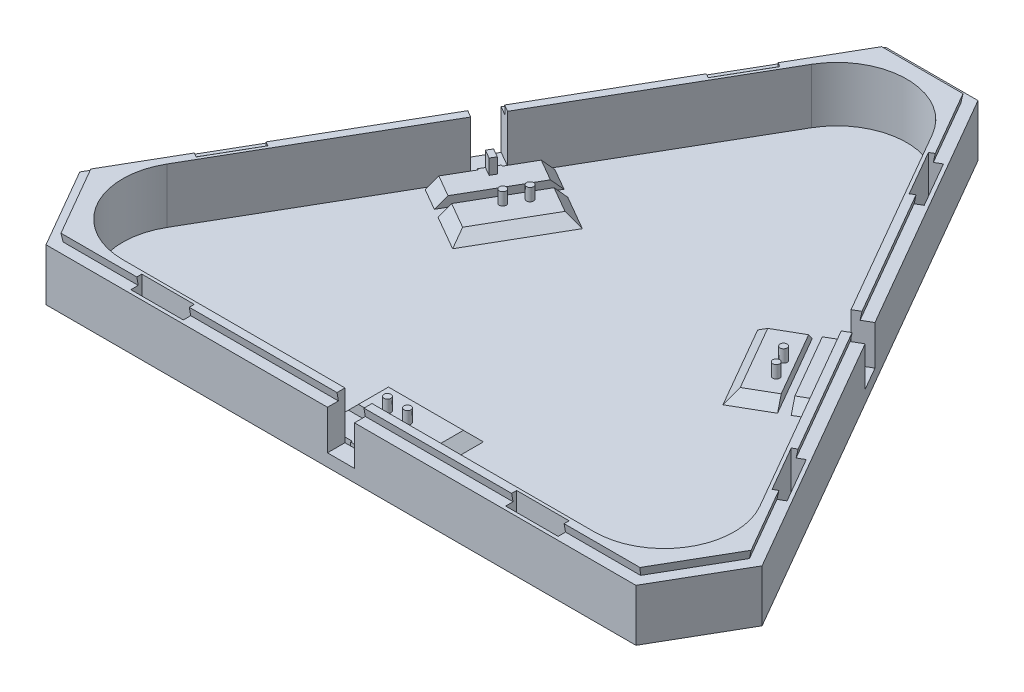
from build123d import *

# Parameters (mm, degrees)
BOSS_EXTRU_1_DEPTH                        = 12
ENL_V_MAT_EXTRU_1_DEPTH                   = 119.989845505
ENL_V_MAT_EXTRU_2_DEPTH                   = 11
ESQUISSE4_W                               = 5.4
ESQUISSE4_H                               = 3.5
ENL_V_MAT_EXTRU_3_DEPTH                   = 9.5
BOSS_EXTRU_2_DEPTH                        = 2
ESQUISSE13_R                              = 0.7
BOSS_EXTRU_3_DEPTH                        = 2.5
BOSS_EXTRU_8_DEPTH                        = 3
CHANFREIN4_SIZE                           = 2
ENL_V_MAT_EXTRU_11_DEPTH                  = 2
R_P_TITION_START                          = 1
R_P_TITION_CIRCULAIRE1_OUTLINE_W          = 1.2
R_P_TITION_CIRCULAIRE1_OUTLINE_H          = 2
R_P_TITION_CIRCULAIRE1_OUTLINE_R          = 0.7
R_P_TITION_CIRCULAIRE1_DEPTH              = 4.5
R_P_TITION_START_2                        = 5.5
R_P_TITION_CIRCULAIRE1_2_OUTLINE_W        = 1.2
R_P_TITION_CIRCULAIRE1_2_OUTLINE_H        = 2
R_P_TITION_CIRCULAIRE1_2_DEPTH            = 0.5
ENL_V_DE_MAT_EXTRU_MINCE1_DEPTH           = 1.6
ENL_V_DE_MAT_EXTRU_MINCE1_DRAFT           = 10
ENL_V_DE_MAT_EXTRU_MINCE1_PROFILE_2_DEPTH = 1.6
ENL_V_DE_MAT_EXTRU_MINCE1_PROFILE_2_DRAFT = 10
ENL_V_DE_MAT_EXTRU_MINCE1_PROFILE_3_DEPTH = 1.6
ENL_V_DE_MAT_EXTRU_MINCE1_PROFILE_3_DRAFT = 10
ESQUISSE18_W                              = 10.5
ESQUISSE18_H                              = 2.2
ENL_V_MAT_EXTRU_10_DEPTH                  = 11


with BuildPart() as part:
    # Esquisse1 → Boss.-Extru.1 (new body)
    with BuildSketch(Plane(origin=(0, 0, 0), x_dir=(1, 0, 0), z_dir=(0, 1, 0))):
        Polygon((-77.5, -44.744645862), (77.5, -44.744645862), (0, 89.489291724), align=None)
    extrude(amount=BOSS_EXTRU_1_DEPTH)

    # Esquisse2 → Enlèv. mat.-Extru.1 (cut, through all)
    with BuildSketch(Plane(origin=(0, 12, 0), x_dir=(1, 0, 0), z_dir=(0, 1, 0))):
        Polygon((-9.237604307, 73.489291724), (9.237604307, 73.489291724), (0, 89.489291724), align=None)
        Polygon((77.5, -44.744645862), (68.262395693, -28.744645862), (59.024791386, -44.744645862), align=None)
        Polygon((-77.5, -44.744645862), (-59.024791386, -44.744645862), (-68.262395693, -28.744645862), align=None)
    extrude(amount=-ENL_V_MAT_EXTRU_1_DEPTH, mode=Mode.SUBTRACT)

    # Esquisse3 → Enlèv. mat.-Extru.2 (cut)
    with BuildSketch(Plane(origin=(0, 12, 0), x_dir=(1, 0, 0), z_dir=(0, 1, 0))):
        with BuildLine():
            Line((59.313466521, -20.244645862), (12.124355653, 61.489291724))
            ThreePointArc((12.124355653, 61.489291724), (0, 68.489291724), (-12.124355653, 61.489291724))
            Line((-12.124355653, 61.489291724), (-59.313466521, -20.244645862))
            ThreePointArc((-59.313466521, -20.244645862), (-59.313466521, -34.244645862), (-47.189110868, -41.244645862))
            Line((-47.189110868, -41.244645862), (47.189110868, -41.244645862))
            ThreePointArc((47.189110868, -41.244645862), (59.313466521, -34.244645862), (59.313466521, -20.244645862))
        make_face()
    extrude(amount=-ENL_V_MAT_EXTRU_2_DEPTH, mode=Mode.SUBTRACT)

    # Esquisse4 → Enlèv. mat.-Extru.3 (cut)
    with BuildSketch(Plane(origin=(0, 12, 0), x_dir=(1, 0, 0), z_dir=(0, 1, 0))):
        Polygon((37.068911087, 18.284054341), (34.368911087, 22.960591521), (37.4, 24.710591521), (40.1, 20.034054341), align=None)
        with Locations((0, -42.994645862)):
            Rectangle(ESQUISSE4_W, ESQUISSE4_H)
        Polygon((-37.4, 24.710591521), (-34.368911087, 22.960591521), (-37.068911087, 18.284054341), (-40.1, 20.034054341), align=None)
    extrude(amount=-ENL_V_MAT_EXTRU_3_DEPTH, mode=Mode.SUBTRACT)

    # Esquisse12 → Boss.-Extru.2 (add)
    with BuildSketch(Plane(origin=(0, 1, 0), x_dir=(1, 0, 0), z_dir=(0, 1, 0))):
        Polygon((20.277568136, 20.367513459), (27.777568136, 7.377132403), (39.035898385, 13.877132403), (36.160898385, 18.856778474), (36.420706006, 19.006778474), (34.670706006, 22.037867388), (34.410898385, 21.887867388), (31.535898385, 26.867513459), align=None)
    extrude(amount=BOSS_EXTRU_2_DEPTH)

    # Esquisse13 → Boss.-Extru.3 (add)
    with BuildSketch(Plane(origin=(0, 3, 0), x_dir=(1, 0, 0), z_dir=(0, 1, 0))):
        with Locations(Location((27.414874832, 16.405335633, 0), (0, 0, 90))):
            Circle(ESQUISSE13_R)
        with Locations(Location((29.414874832, 12.941234018, 0), (0, 0, 90))):
            Circle(ESQUISSE13_R)
    extrude(amount=BOSS_EXTRU_3_DEPTH)

    # Esquisse20 → Boss.-Extru.8 (add, symmetric)
    with BuildSketch(Plane(origin=(0, 3, 0), x_dir=(1, 0, 0), z_dir=(0, 1, 0))):
        Polygon((35.245706006, 21.041938173), (35.845706006, 20.002707689), (34.113655198, 19.002707689), (33.513655198, 20.041938173), align=None)
    extrude(amount=BOSS_EXTRU_8_DEPTH, both=True)

    # Chanfrein4
    chanfrein4_edges = [part.edges().sort_by_distance(p)[0] for p in [
        (25.90673326, 1, -23.617513459),
        (24.027568136, 1, -13.872322931),
        (33.40673326, 1, -10.627132403),
    ]]
    chamfer(chanfrein4_edges, length=CHANFREIN4_SIZE - 0.0001)  # a hair under: the kernel refuses the full size

    # Esquisse21 → Enlèv. mat.-Extru.11 (cut)
    with BuildSketch(Plane(origin=(0, 3, 0), x_dir=(1, 0, 0), z_dir=(0, 1, 0))):
        Polygon((24.473720558, 25.099564267), (26.205771366, 26.099564267), (35.705771366, 9.645081595), (33.973720558, 8.645081595), align=None)
    extrude(amount=-ENL_V_MAT_EXTRU_11_DEPTH, mode=Mode.SUBTRACT)

    # Répétition circulaire1: read off the stored shape, not the designer's step
    # Répétition circulaire1 outline → Répétition circulaire1 (add)
    with BuildSketch(Plane(origin=(0, 0, 0), x_dir=(1, 0, 0), z_dir=(0, 1, 0)).offset(R_P_TITION_START)):
        Polygon((-35.245706006, 21.041938173), (-35.845706006, 20.002707689), (-34.113655198, 19.002707689), (-33.513655198, 20.041938173), align=None)
        with Locations((0, -40.044645862)):
            Rectangle(R_P_TITION_CIRCULAIRE1_OUTLINE_W, R_P_TITION_CIRCULAIRE1_OUTLINE_H)
        with Locations((-27.914874832, 15.539310229)):
            Circle(R_P_TITION_CIRCULAIRE1_OUTLINE_R)
        with Locations((-25.914874832, 19.003411844)):
            Circle(R_P_TITION_CIRCULAIRE1_OUTLINE_R)
        with Locations((0.5, -31.944645862)):
            Circle(R_P_TITION_CIRCULAIRE1_OUTLINE_R)
        with Locations((-3.5, -31.944645862)):
            Circle(R_P_TITION_CIRCULAIRE1_OUTLINE_R)
    extrude(amount=R_P_TITION_CIRCULAIRE1_DEPTH)

    # R_p_tition circulaire1 2 outline → R_p_tition circulaire1 2 (add)
    with BuildSketch(Plane(origin=(0, 0, 0), x_dir=(1, 0, 0), z_dir=(0, 1, 0)).offset(R_P_TITION_START_2)):
        Polygon((-35.245706006, 21.041938173), (-35.845706006, 20.002707689), (-34.113655198, 19.002707689), (-33.513655198, 20.041938173), align=None)
        with Locations((0, -40.044645862)):
            Rectangle(R_P_TITION_CIRCULAIRE1_2_OUTLINE_W, R_P_TITION_CIRCULAIRE1_2_OUTLINE_H)
    extrude(amount=R_P_TITION_CIRCULAIRE1_2_DEPTH)

    # R_p_tition circulaire1 3: loft between two sections, ruled curve by curve
    r_p_tition_circulaire1_3_from = [
        Edge.make_line((-25.473720558, 3, -23.367513459), (-20.277568136, 3, -20.367513459)),
        Edge.make_line((-32.973720558, 3, -10.377132403), (-27.777568136, 3, -7.377132403)),
        Edge.make_line((-20.277568136, 3, -20.367513459), (-27.777568136, 3, -7.377132403)),
        Edge.make_line((-32.973720558, 3, -10.377132403), (-25.473720558, 3, -23.367513459)),
    ]
    r_p_tition_circulaire1_3_to = [
        Edge.make_line((-24.473720558, 1, -25.099564267), (-17.545517328, 1, -21.099564267)),
        Edge.make_line((-33.973720558, 1, -8.645081595), (-27.045517328, 1, -4.645081595)),
        Edge.make_line((-17.545517328, 1, -21.099564267), (-27.045517328, 1, -4.645081595)),
        Edge.make_line((-33.973720558, 1, -8.645081595), (-24.473720558, 1, -25.099564267)),
    ]
    r_p_tition_circulaire1_3 = Solid(Shell([*[Face.make_surface_from_curves(r_p_tition_circulaire1_3_from[k], r_p_tition_circulaire1_3_to[k]) for k in range(4)], Face(Wire(r_p_tition_circulaire1_3_from)), Face(Wire(r_p_tition_circulaire1_3_to))]))
    add(r_p_tition_circulaire1_3)

    # R_p_tition circulaire1 4: loft between two sections, ruled curve by curve
    r_p_tition_circulaire1_4_from = [
        Edge.make_line((-7.5, 3, 33.744645862), (-7.5, 3, 27.744645862)),
        Edge.make_line((7.5, 3, 33.744645862), (7.5, 3, 27.744645862)),
        Edge.make_line((-7.5, 3, 27.744645862), (7.5, 3, 27.744645862)),
        Edge.make_line((7.5, 3, 33.744645862), (-7.5, 3, 33.744645862)),
    ]
    r_p_tition_circulaire1_4_to = [
        Edge.make_line((-9.5, 1, 33.744645862), (-9.5, 1, 25.744645862)),
        Edge.make_line((9.5, 1, 33.744645862), (9.5, 1, 25.744645862)),
        Edge.make_line((-9.5, 1, 25.744645862), (9.5, 1, 25.744645862)),
        Edge.make_line((9.5, 1, 33.744645862), (-9.5, 1, 33.744645862)),
    ]
    r_p_tition_circulaire1_4 = Solid(Shell([*[Face.make_surface_from_curves(r_p_tition_circulaire1_4_from[k], r_p_tition_circulaire1_4_to[k]) for k in range(4)], Face(Wire(r_p_tition_circulaire1_4_from)), Face(Wire(r_p_tition_circulaire1_4_to))]))
    add(r_p_tition_circulaire1_4)

    # R_p_tition circulaire1 5: loft between two sections, ruled curve by curve
    r_p_tition_circulaire1_5_from = [
        Edge.make_line((-27.205771366, 3, -24.367513459), (-31.535898385, 3, -26.867513459)),
        Edge.make_line((-34.705771366, 3, -11.377132403), (-39.035898385, 3, -13.877132403)),
        Edge.make_line((-34.410898385, 3, -21.887867388), (-31.535898385, 3, -26.867513459)),
        Edge.make_line((-39.035898385, 3, -13.877132403), (-36.160898385, 3, -18.856778474)),
        Edge.make_line((-34.670706006, 3, -22.037867388), (-34.410898385, 3, -21.887867388)),
        Edge.make_line((-36.160898385, 3, -18.856778474), (-36.420706006, 3, -19.006778474)),
        Edge.make_line((-27.205771366, 3, -24.367513459), (-34.705771366, 3, -11.377132403)),
        Edge.make_line((-36.420706006, 3, -19.006778474), (-34.670706006, 3, -22.037867388)),
    ]
    r_p_tition_circulaire1_5_to = [
        Edge.make_line((-26.205771366, 1, -26.099564267), (-30.535898385, 1, -28.599564267)),
        Edge.make_line((-35.705771366, 1, -9.645081595), (-40.035898385, 1, -12.145081595)),
        Edge.make_line((-34.410898385, 1, -21.887867388), (-30.535898385, 1, -28.599564267)),
        Edge.make_line((-40.035898385, 1, -12.145081595), (-36.160898385, 1, -18.856778474)),
        Edge.make_line((-34.670706006, 1, -22.037867388), (-34.410898385, 1, -21.887867388)),
        Edge.make_line((-36.160898385, 1, -18.856778474), (-36.420706006, 1, -19.006778474)),
        Edge.make_line((-26.205771366, 1, -26.099564267), (-35.705771366, 1, -9.645081595)),
        Edge.make_line((-36.420706006, 1, -19.006778474), (-34.670706006, 1, -22.037867388)),
    ]
    r_p_tition_circulaire1_5 = Solid(Shell([*[Face.make_surface_from_curves(r_p_tition_circulaire1_5_from[k], r_p_tition_circulaire1_5_to[k]) for k in range(8)], Face(Wire(r_p_tition_circulaire1_5_from)), Face(Wire(r_p_tition_circulaire1_5_to))]))
    add(r_p_tition_circulaire1_5)

    # R_p_tition circulaire1 6: loft between two sections, ruled curve by curve
    r_p_tition_circulaire1_6_from = [
        Edge.make_line((-7.5, 3, 35.744645862), (-7.5, 3, 40.744645862)),
        Edge.make_line((7.5, 3, 35.744645862), (7.5, 3, 40.744645862)),
        Edge.make_line((-1.75, 3, 40.744645862), (-7.5, 3, 40.744645862)),
        Edge.make_line((7.5, 3, 40.744645862), (1.75, 3, 40.744645862)),
        Edge.make_line((-1.75, 3, 41.044645862), (-1.75, 3, 40.744645862)),
        Edge.make_line((1.75, 3, 40.744645862), (1.75, 3, 41.044645862)),
        Edge.make_line((-7.5, 3, 35.744645862), (7.5, 3, 35.744645862)),
        Edge.make_line((1.75, 3, 41.044645862), (-1.75, 3, 41.044645862)),
    ]
    r_p_tition_circulaire1_6_to = [
        Edge.make_line((-9.5, 1, 35.744645862), (-9.5, 1, 40.744645862)),
        Edge.make_line((9.5, 1, 35.744645862), (9.5, 1, 40.744645862)),
        Edge.make_line((-1.75, 1, 40.744645862), (-9.5, 1, 40.744645862)),
        Edge.make_line((9.5, 1, 40.744645862), (1.75, 1, 40.744645862)),
        Edge.make_line((-1.75, 1, 41.044645862), (-1.75, 1, 40.744645862)),
        Edge.make_line((1.75, 1, 40.744645862), (1.75, 1, 41.044645862)),
        Edge.make_line((-9.5, 1, 35.744645862), (9.5, 1, 35.744645862)),
        Edge.make_line((1.75, 1, 41.044645862), (-1.75, 1, 41.044645862)),
    ]
    r_p_tition_circulaire1_6 = Solid(Shell([*[Face.make_surface_from_curves(r_p_tition_circulaire1_6_from[k], r_p_tition_circulaire1_6_to[k]) for k in range(8)], Face(Wire(r_p_tition_circulaire1_6_from)), Face(Wire(r_p_tition_circulaire1_6_to))]))
    add(r_p_tition_circulaire1_6)


with BuildPart() as enl_v_de_mat_extru_mince1_tool:
    # Esquisse17 → Enlèv. de mat.-Extru.-Mince1 (with draft: the straight prism first)
    with BuildSketch(Plane(origin=(0, 12, 0), x_dir=(1, 0, 0), z_dir=(0, 1, 0))):
        Polygon((37.4, 24.710591521), (9.237604307, 73.489291724), (-9.237604307, 73.489291724), (-37.4, 24.710591521), (-35.754551733, 23.760591521), (-8.140638796, 71.589291724), (8.140638796, 71.589291724), (35.754551733, 23.760591521), align=None)
    extrude(amount=-ENL_V_DE_MAT_EXTRU_MINCE1_DEPTH)
    # Enlèv. de mat.-Extru.-Mince1: the draft: its side faces are tilted about the plane it starts from
    enl_v_de_mat_extru_mince1_sides = [enl_v_de_mat_extru_mince1_tool.faces().sort_by_distance(p)[0] for p in [
        (23.318802154, 11.2, -49.099941623),
        (0, 11.2, -73.489291724),
        (-23.318802154, 11.2, -49.099941623),
        (-36.577275866, 11.2, -24.235591521),
        (-21.947595264, 11.2, -47.674941623),
        (0, 11.2, -71.589291724),
        (21.947595264, 11.2, -47.674941623),
        (36.577275866, 11.2, -24.235591521),
    ]]
    draft(enl_v_de_mat_extru_mince1_sides, Plane(origin=(0, 12, 0), x_dir=(1, 0, 0), z_dir=(0, 1, 0)), ENL_V_DE_MAT_EXTRU_MINCE1_DRAFT)


with BuildPart() as part_1:
    add(part.part)

    # Enlèv. de mat.-Extru.-Mince1: cut by enl_v_de_mat_extru_mince1_tool
    add(enl_v_de_mat_extru_mince1_tool.part, mode=Mode.SUBTRACT)


with BuildPart() as enl_v_de_mat_extru_mince1_profile_2_tool:
    # Esquisse17 → Enlèv. de mat.-Extru.-Mince1 profile 2 (with draft: the straight prism first)
    with BuildSketch(Plane(origin=(0, 12, 0), x_dir=(1, 0, 0), z_dir=(0, 1, 0))):
        Polygon((-40.1, 20.034054341), (-68.262395693, -28.744645862), (-59.024791386, -44.744645862), (-2.7, -44.744645862), (-2.7, -42.844645862), (-57.927825874, -42.844645862), (-66.06846467, -28.744645862), (-38.454551733, 19.084054341), align=None)
    extrude(amount=-ENL_V_DE_MAT_EXTRU_MINCE1_PROFILE_2_DEPTH)
    # Enlèv. de mat.-Extru.-Mince1 profile 2: the draft: its side faces are tilted about the plane it starts from
    enl_v_de_mat_extru_mince1_profile_2_sides = [enl_v_de_mat_extru_mince1_profile_2_tool.faces().sort_by_distance(p)[0] for p in [
        (-54.181197846, 11.2, 4.355295761),
        (-63.643593539, 11.2, 36.744645862),
        (-30.862395693, 11.2, 44.744645862),
        (-2.7, 11.2, 43.794645862),
        (-30.313912937, 11.2, 42.844645862),
        (-61.998145272, 11.2, 35.794645862),
        (-52.261508201, 11.2, 4.830295761),
        (-39.277275866, 11.2, -19.559054341),
    ]]
    draft(enl_v_de_mat_extru_mince1_profile_2_sides, Plane(origin=(0, 12, 0), x_dir=(1, 0, 0), z_dir=(0, 1, 0)), ENL_V_DE_MAT_EXTRU_MINCE1_PROFILE_2_DRAFT)


with BuildPart() as part_2:
    add(part_1.part)

    # Enlèv. de mat.-Extru.-Mince1 profile 2: cut by enl_v_de_mat_extru_mince1_profile_2_tool
    add(enl_v_de_mat_extru_mince1_profile_2_tool.part, mode=Mode.SUBTRACT)


with BuildPart() as enl_v_de_mat_extru_mince1_profile_3_tool:
    # Esquisse17 → Enlèv. de mat.-Extru.-Mince1 profile 3 (with draft: the straight prism first)
    with BuildSketch(Plane(origin=(0, 12, 0), x_dir=(1, 0, 0), z_dir=(0, 1, 0))):
        Polygon((2.7, -44.744645862), (59.024791386, -44.744645862), (68.262395693, -28.744645862), (40.1, 20.034054341), (38.454551733, 19.084054341), (66.06846467, -28.744645862), (57.927825874, -42.844645862), (2.7, -42.844645862), align=None)
    extrude(amount=-ENL_V_DE_MAT_EXTRU_MINCE1_PROFILE_3_DEPTH)
    # Enlèv. de mat.-Extru.-Mince1 profile 3: the draft: its side faces are tilted about the plane it starts from
    enl_v_de_mat_extru_mince1_profile_3_sides = [enl_v_de_mat_extru_mince1_profile_3_tool.faces().sort_by_distance(p)[0] for p in [
        (30.862395693, 11.2, 44.744645862),
        (63.643593539, 11.2, 36.744645862),
        (54.181197846, 11.2, 4.355295761),
        (39.277275866, 11.2, -19.559054341),
        (52.261508201, 11.2, 4.830295761),
        (61.998145272, 11.2, 35.794645862),
        (30.313912937, 11.2, 42.844645862),
        (2.7, 11.2, 43.794645862),
    ]]
    draft(enl_v_de_mat_extru_mince1_profile_3_sides, Plane(origin=(0, 12, 0), x_dir=(1, 0, 0), z_dir=(0, 1, 0)), ENL_V_DE_MAT_EXTRU_MINCE1_PROFILE_3_DRAFT)


with BuildPart() as part_3:
    add(part_2.part)

    # Enlèv. de mat.-Extru.-Mince1 profile 3: cut by enl_v_de_mat_extru_mince1_profile_3_tool
    add(enl_v_de_mat_extru_mince1_profile_3_tool.part, mode=Mode.SUBTRACT)

    # Esquisse18 → Enlèv. mat.-Extru.10 (cut)
    with BuildSketch(Plane(origin=(0, 12, 0), x_dir=(1, 0, 0), z_dir=(0, 1, 0))):
        with Locations((37.5, -42.944645862)):
            Rectangle(ESQUISSE18_W, ESQUISSE18_H)
        with Locations((-37.5, -42.944645862)):
            Rectangle(ESQUISSE18_W, ESQUISSE18_H)
        Polygon((-52.363526329, -7.006996341), (-57.613526329, -16.100263081), (-59.518782217, -15.000263081), (-54.268782217, -5.906996341), align=None)
        Polygon((-20.113526329, 48.851642203), (-22.018782217, 49.951642203), (-16.768782217, 59.044908943), (-14.863526329, 57.944908943), align=None)
        Polygon((20.113526329, 48.851642203), (14.863526329, 57.944908943), (16.768782217, 59.044908943), (22.018782217, 49.951642203), align=None)
        Polygon((52.363526329, -7.006996341), (54.268782217, -5.906996341), (59.518782217, -15.000263081), (57.613526329, -16.100263081), align=None)
    extrude(amount=-ENL_V_MAT_EXTRU_10_DEPTH, mode=Mode.SUBTRACT)


solid = part_3.part
